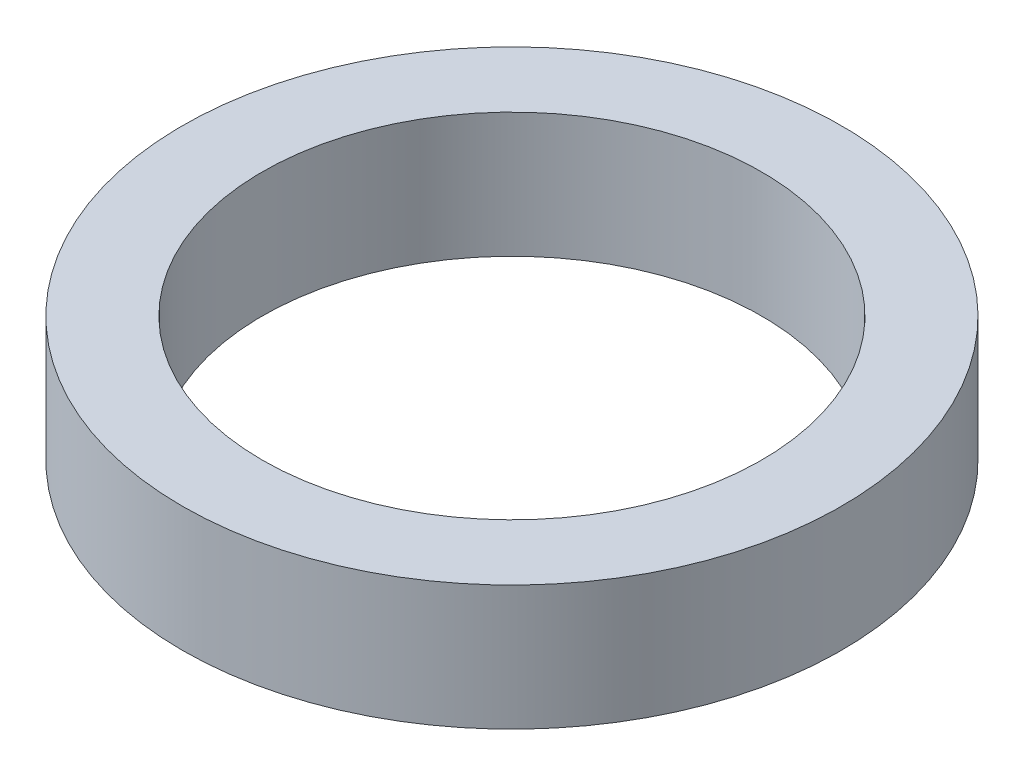
from build123d import *

# Parameters (mm, degrees)
SKETCH1_R           = 4.191
SKETCH1_R_2         = 3.175
BOSS_EXTRUDE1_DEPTH = 1.5875


with BuildPart() as part:
    # Sketch1 → Boss-Extrude1 (new body)
    with BuildSketch(Plane(origin=(0, 0, 0), x_dir=(1, 0, 0), z_dir=(0, 1, 0))):
        Circle(SKETCH1_R)
        Circle(SKETCH1_R_2, mode=Mode.SUBTRACT)
    extrude(amount=BOSS_EXTRUDE1_DEPTH)


solid = part.part
